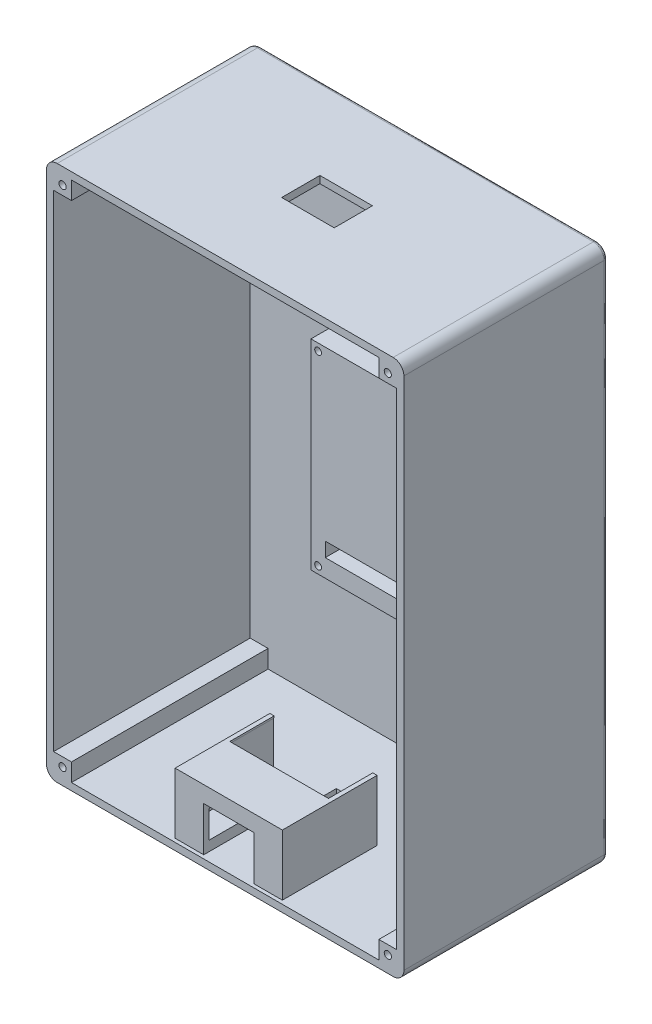
from build123d import *

# Parameters (mm, degrees)
SKETCH_1_W          = 100
SKETCH_1_H          = 150
EXTRUDE_1_DEPTH     = 2
SKETCH_2_W          = 100
SKETCH_2_H          = 150
SKETCH_2_W_2        = 96
SKETCH_2_H_2        = 146
EXTRUDE_2_DEPTH     = 55
EXTRUDE_3_DEPTH     = 17
SKETCH_7_W          = 28
SKETCH_7_H          = 2.2
EXTRUDE_4_DEPTH     = 6.6
SKETCH_8_W          = 28
SKETCH_8_H          = 4.3
EXTRUDE_5_DEPTH     = 12.6
SKETCH_9_W          = 12.4
SKETCH_9_H          = 0.5
EXTRUDE_6_DEPTH     = 0.2
SKETCH_10_W         = 12.4
SKETCH_10_H         = 0.5
EXTRUDE_7_DEPTH     = 0.2
SKETCH_12_W         = 28
SKETCH_12_H         = 2.8
EXTRUDE_10_DEPTH    = 11.4
CUT_EXTRUDE_1_REACH = 168.292
SKETCH_13_W         = 9.2
SKETCH_13_H         = 9.2
SKETCH_14_W         = 13.2
SKETCH_14_H         = 13.2
SKETCH_14_W_2       = 9.2
SKETCH_14_H_2       = 9.2
EXTRUDE_11_DEPTH    = 2
CUT_EXTRUDE_2_REACH = 171.862
SKETCH_16_W         = 14.7
SKETCH_16_H         = 10.7
FILLET_2_R          = 3
FILLET_3_R          = 1
SKETCH_17_W         = 5
SKETCH_17_H         = 5
SKETCH_17_R         = 1
EXTRUDE_13_DEPTH    = 55
SKETCH_18_W         = 14
SKETCH_18_H         = 12.408589395
CUT_EXTRUDE_3_DEPTH = 20
SKETCH_19_W         = 32
SKETCH_19_H         = 56
EXTRUDE_14_DEPTH    = 15
SKETCH_21_W         = 24
SKETCH_21_H         = 48
CUT_EXTRUDE_4_DEPTH = 12
SKETCH_24_R         = 0.95
CUT_EXTRUDE_5_DEPTH = 184
SKETCH_25_W         = 24
SKETCH_25_H         = 4
CUT_EXTRUDE_6_DEPTH = 44


with BuildPart() as part:
    # 草图1 → 凸台-拉伸1 (new body)
    with BuildSketch(Plane.XY):
        Rectangle(SKETCH_1_W, SKETCH_1_H)
    extrude(amount=EXTRUDE_1_DEPTH)

    # 草图2 → 凸台-拉伸2 (add)
    with BuildSketch(Plane.XY.offset(2)):
        Rectangle(SKETCH_2_W, SKETCH_2_H)
        Rectangle(SKETCH_2_W_2, SKETCH_2_H_2, mode=Mode.SUBTRACT)
    extrude(amount=EXTRUDE_2_DEPTH)

    # 草图6 → 凸台-拉伸3 (add)
    with BuildSketch(Plane(origin=(0, -73, 0), x_dir=(1, 0, 0), z_dir=(0, 1, 0))):
        Polygon((-15, -56), (15, -56), (15, -29.5), (14, -29.5), (14, -54.5), (-14, -54.5), (-14, -29.5), (-15, -29.5), align=None)
    extrude(amount=EXTRUDE_3_DEPTH)

    # 草图7 → 凸台-拉伸4 (add)
    with BuildSketch(Plane(origin=(0, 0, 54.5), x_dir=(-1, 0, 0), z_dir=(0, 0, -1))):
        with Locations((0, -61.4)):
            Rectangle(SKETCH_7_W, SKETCH_7_H)
    extrude(amount=EXTRUDE_4_DEPTH)

    # 草图8 → 凸台-拉伸5 (add)
    with BuildSketch(Plane(origin=(0, 0, 54.5), x_dir=(-1, 0, 0), z_dir=(0, 0, -1))):
        with Locations((0, -58.15)):
            Rectangle(SKETCH_8_W, SKETCH_8_H)
    extrude(amount=EXTRUDE_5_DEPTH)

    # 草图9 → 凸台-拉伸6 (add)
    with BuildSketch(Plane(origin=(-14, 0, 0), x_dir=(0, 0, -1), z_dir=(1, 0, 0))):
        with Locations((-35.7, -56.25)):
            Rectangle(SKETCH_9_W, SKETCH_9_H)
    extrude(amount=EXTRUDE_6_DEPTH)

    # 草图10 → 凸台-拉伸7 (add)
    with BuildSketch(Plane.ZY.offset(-14)):
        with Locations((35.7, -56.25)):
            Rectangle(SKETCH_10_W, SKETCH_10_H)
    extrude(amount=EXTRUDE_7_DEPTH)

    # 草图12 → 凸台-拉伸10 (add)
    with BuildSketch(Plane(origin=(0, 0, 54.5), x_dir=(-1, 0, 0), z_dir=(0, 0, -1))):
        with Locations((0, -71.6)):
            Rectangle(SKETCH_12_W, SKETCH_12_H)
    extrude(amount=EXTRUDE_10_DEPTH)

    # 草图13 → 切除-拉伸1 (cut, up to next)
    with BuildSketch(Plane(origin=(0, -73, 0), x_dir=(1, 0, 0), z_dir=(0, 1, 0)), mode=Mode.PRIVATE) as cut_extrude_1_sk1:
        with Locations((0.1, -26)):
            Rectangle(SKETCH_13_W, SKETCH_13_H)
    cut_extrude_1_tool1 = extrude(cut_extrude_1_sk1.sketch, amount=-CUT_EXTRUDE_1_REACH, mode=Mode.PRIVATE) & part.part
    add(cut_extrude_1_tool1.solids().sort_by_distance((0.1, -73, 26))[0], mode=Mode.SUBTRACT)

    # 草图14 → 凸台-拉伸11 (add)
    with BuildSketch(Plane.XZ.offset(75)):
        with Locations((0.1, 26)):
            Rectangle(SKETCH_14_W, SKETCH_14_H)
        with Locations((0.1, 26)):
            Rectangle(SKETCH_14_W_2, SKETCH_14_H_2, mode=Mode.SUBTRACT)
    extrude(amount=EXTRUDE_11_DEPTH)

    # 草图16 → 切除-拉伸2 (cut, up to next)
    with BuildSketch(Plane(origin=(0, 75, 0), x_dir=(1, 0, 0), z_dir=(0, 1, 0)), mode=Mode.PRIVATE) as cut_extrude_2_sk1:
        with Locations((0, -28.5)):
            Rectangle(SKETCH_16_W, SKETCH_16_H)
    cut_extrude_2_tool1 = extrude(cut_extrude_2_sk1.sketch, amount=-CUT_EXTRUDE_2_REACH, mode=Mode.PRIVATE) & part.part
    add(cut_extrude_2_tool1.solids().sort_by_distance((0, 75, 28.5))[0], mode=Mode.SUBTRACT)

    # 变化圆角2
    fillet_2_edges = [part.edges().sort_by_distance(p)[0] for p in [
        (50, -75, 28.5),
        (-50, -75, 28.5),
        (-50, 75, 28.5),
        (50, 75, 28.5),
    ]]
    fillet(fillet_2_edges, radius=FILLET_2_R)

    # 变化圆角3
    fillet_3_edges = [part.edges().sort_by_distance(p)[0] for p in [
        (50, 0, 0),
        (0, 75, 0),
        (-50, 0, 0),
        (0, -75, 0),
    ]]
    fillet(fillet_3_edges, radius=FILLET_3_R)

    # 草图17 → 凸台-拉伸13 (add)
    # profile 1 of 4: a face of its own
    with BuildSketch(Plane.XY.offset(2)):
        with Locations((45.5, 70.5)):
            Rectangle(SKETCH_17_W, SKETCH_17_H)
        with Locations((45.5, 70.5)):
            Circle(SKETCH_17_R, mode=Mode.SUBTRACT)
    # profile 2 of 4: a face of its own
    with BuildSketch(Plane.XY.offset(2)):
        with Locations((-45.5, 70.5)):
            Rectangle(SKETCH_17_W, SKETCH_17_H)
        with Locations((-45.5, 70.5)):
            Circle(SKETCH_17_R, mode=Mode.SUBTRACT)
    # profile 3 of 4: a face of its own
    with BuildSketch(Plane.XY.offset(2)):
        with Locations((-45.5, -70.5)):
            Rectangle(SKETCH_17_W, SKETCH_17_H)
        with Locations((-45.5, -70.5)):
            Circle(SKETCH_17_R, mode=Mode.SUBTRACT)
    # profile 4 of 4: a face of its own
    with BuildSketch(Plane.XY.offset(2)):
        with Locations((45.5, -70.5)):
            Rectangle(SKETCH_17_W, SKETCH_17_H)
        with Locations((45.5, -70.5)):
            Circle(SKETCH_17_R, mode=Mode.SUBTRACT)
    extrude(amount=EXTRUDE_13_DEPTH)

    # 草图18 → 切除-拉伸3 (cut)
    with BuildSketch(Plane.XY.offset(56)):
        with Locations((0, -66.795705303)):
            Rectangle(SKETCH_18_W, SKETCH_18_H)
    extrude(amount=-CUT_EXTRUDE_3_DEPTH, mode=Mode.SUBTRACT)

    # 草图19 → 凸台-拉伸14 (add)
    with BuildSketch(Plane.XY.offset(2)):
        Rectangle(SKETCH_19_W, SKETCH_19_H)
    extrude(amount=EXTRUDE_14_DEPTH)

    # 草图21 → 切除-拉伸4 (cut)
    with BuildSketch(Plane(origin=(0, 0, 0), x_dir=(-1, 0, 0), z_dir=(0, 0, -1))):
        Rectangle(SKETCH_21_W, SKETCH_21_H)
    extrude(amount=-CUT_EXTRUDE_4_DEPTH, mode=Mode.SUBTRACT)

    # 草图24 → 切除-拉伸5 (cut)
    with BuildSketch(Plane.XY.offset(17)):
        with Locations((14, 26)):
            Circle(SKETCH_24_R)
        with Locations((14, -26)):
            Circle(SKETCH_24_R)
        with Locations((-14, -26)):
            Circle(SKETCH_24_R)
        with Locations((-14, 26)):
            Circle(SKETCH_24_R)
    extrude(amount=-CUT_EXTRUDE_5_DEPTH, mode=Mode.SUBTRACT)

    # 草图25 → 切除-拉伸6 (cut)
    with BuildSketch(Plane.XY.offset(17)):
        with Locations((0, -21)):
            Rectangle(SKETCH_25_W, SKETCH_25_H)
    extrude(amount=-CUT_EXTRUDE_6_DEPTH, mode=Mode.SUBTRACT)


solid = part.part
